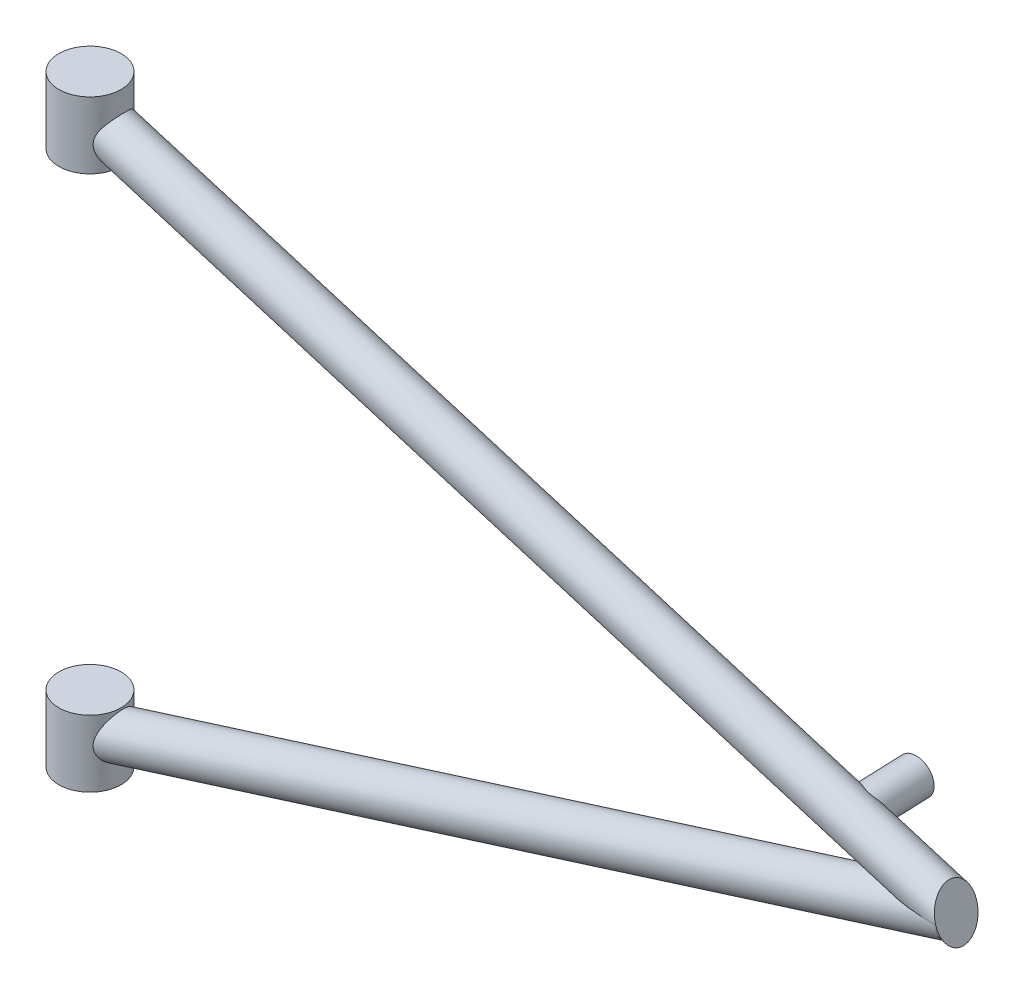
from build123d import *

# Parameters (mm, degrees)
SUSP_FR_LCA_FRONT_LEG_PROFILE_R         = 9.525
SUSP_FR_LCA_REAR_LEG_START              = 194.971257269
SUSP_FR_LCA_REAR_LEG_OUTLINE_R          = 9.525
SUSP_FR_LCA_REAR_LEG_DEPTH              = 392.368202981
SUSP_FR_LCA_REAR_LEG_START_2            = 587.33946025
SUSP_FR_LCA_REAR_LEG_2_OUTLINE_R        = 9.525
SUSP_FR_LCA_REAR_LEG_2_DEPTH            = 13.53250199
SUSP_FR_LCA_REAR_LEG_START_3            = 523.39106775
SUSP_FR_LCA_REAR_LEG_3_OUTLINE_W        = 26
SUSP_FR_LCA_REAR_LEG_3_OUTLINE_H        = 23
SUSP_FR_LCA_REAR_LEG_3_DEPTH            = 11.60893225
SUSP_FR_LCA_BUSH_FRONT_PROFILE_R        = 14
SUSP_FR_LCA_BUSH_REAR_PROFILE_R         = 14
SUSP_FR_PUSHROD_MOUNT_BRACKET_PROFILE_R = 8


with BuildPart() as part:
    # SUSP_FR_LCA_front_leg: sweep along a curve in space
    with BuildLine() as susp_fr_lca_front_leg_path:
        Line((205, -240.84, -42.383), (582, -130.461196, -55))
    # SUSP_FR_LCA_front_leg profile (on start of the path) → SUSP_FR_LCA_front_leg (sweep)
    with BuildSketch(Plane(origin=(205, -240.84, -42.383), x_dir=(-0.2809863080066093, 0.9597117768959672, 0), z_dir=(0.9592171404331008, 0.28084148736685866, -0.03210196992266429))):
        Circle(SUSP_FR_LCA_FRONT_LEG_PROFILE_R)
    sweep(path=susp_fr_lca_front_leg_path.line)

    # SUSP_FR_LCA_rear_leg: read off the stored shape, not the designer's step
    # SUSP_FR_LCA_rear_leg outline → SUSP_FR_LCA_rear_leg (add)
    with BuildSketch(Plane(origin=(0, 0, 0), x_dir=(0.3266773785489796, 0.9450726759891053, -0.01093286070332221), z_dir=(0.9445438654680327, -0.3268602715210149, -0.031610901725756396)).offset(SUSP_FR_LCA_REAR_LEG_START)):
        with Locations((67.432230038, -35.502420765)):
            Circle(SUSP_FR_LCA_REAR_LEG_OUTLINE_R)
    extrude(amount=SUSP_FR_LCA_REAR_LEG_DEPTH)

    # SUSP_FR_LCA_rear_leg 2 outline → SUSP_FR_LCA_rear_leg 2 (add)
    with BuildSketch(Plane(origin=(0, 0, 0), x_dir=(0.3266773785489796, 0.9450726759891053, -0.01093286070332221), z_dir=(0.9445438654680327, -0.3268602715210149, -0.031610901725756396)).offset(SUSP_FR_LCA_REAR_LEG_START_2)):
        with Locations((67.432230038, -35.502420765)):
            Circle(SUSP_FR_LCA_REAR_LEG_2_OUTLINE_R)
    extrude(amount=SUSP_FR_LCA_REAR_LEG_2_DEPTH)

    # SUSP_FR_LCA_rear_leg 3 outline → SUSP_FR_LCA_rear_leg 3 (cut)
    with BuildSketch(Plane(origin=(0, 0, 0), x_dir=(-0.28068434396715386, 0.959754165905817, 0.009393619012821172), z_dir=(0.9592171404331008, 0.2808414873668589, -0.03210196992266429)).offset(SUSP_FR_LCA_REAR_LEG_START_3)):
        with Locations((-289, -35.5)):
            Rectangle(SUSP_FR_LCA_REAR_LEG_3_OUTLINE_W, SUSP_FR_LCA_REAR_LEG_3_OUTLINE_H)
    extrude(amount=SUSP_FR_LCA_REAR_LEG_3_DEPTH, mode=Mode.SUBTRACT)

    # SUSP_FR_LCA_bush_front: sweep along a curve in space
    with BuildLine() as susp_fr_lca_bush_front_path:
        Line((205, -255.84, -42.383), (205, -225.84, -42.383))
    # SUSP_FR_LCA_bush_front profile (on start of the path) → SUSP_FR_LCA_bush_front (sweep)
    with BuildSketch(Plane(origin=(205, -255.84, -42.383), x_dir=(0, 0, 1), z_dir=(0, 1, 0))):
        Circle(SUSP_FR_LCA_BUSH_FRONT_PROFILE_R)
    sweep(path=susp_fr_lca_bush_front_path.line)

    # SUSP_FR_LCA_bush_rear: sweep along a curve in space
    with BuildLine() as susp_fr_lca_bush_rear_path:
        Line((205, -15, -42.383), (205, 15, -42.383))
    # SUSP_FR_LCA_bush_rear profile (on start of the path) → SUSP_FR_LCA_bush_rear (sweep)
    with BuildSketch(Plane(origin=(205, -15, -42.383), x_dir=(0, 0, 1), z_dir=(0, 1, 0))):
        Circle(SUSP_FR_LCA_BUSH_REAR_PROFILE_R)
    sweep(path=susp_fr_lca_bush_rear_path.line)

    # SUSP_FR_pushrod_mount_bracket: sweep along a curve in space
    with BuildLine() as susp_fr_pushrod_mount_bracket_path:
        Line((536.521845, -114.723439, -53.4779897), (535.6, -114.51, -83.23))
    # SUSP_FR_pushrod_mount_bracket profile (on start of the path) → SUSP_FR_pushrod_mount_bracket (sweep)
    with BuildSketch(Plane(origin=(536.521845, -114.723439, -53.4779897), x_dir=(-0.9995203321410445, 0, 0.0309694306802064), z_dir=(-0.030968634548961455, 0.007170309964793488, -0.999494637468947))):
        Circle(SUSP_FR_PUSHROD_MOUNT_BRACKET_PROFILE_R)
    sweep(path=susp_fr_pushrod_mount_bracket_path.line)


solid = part.part
